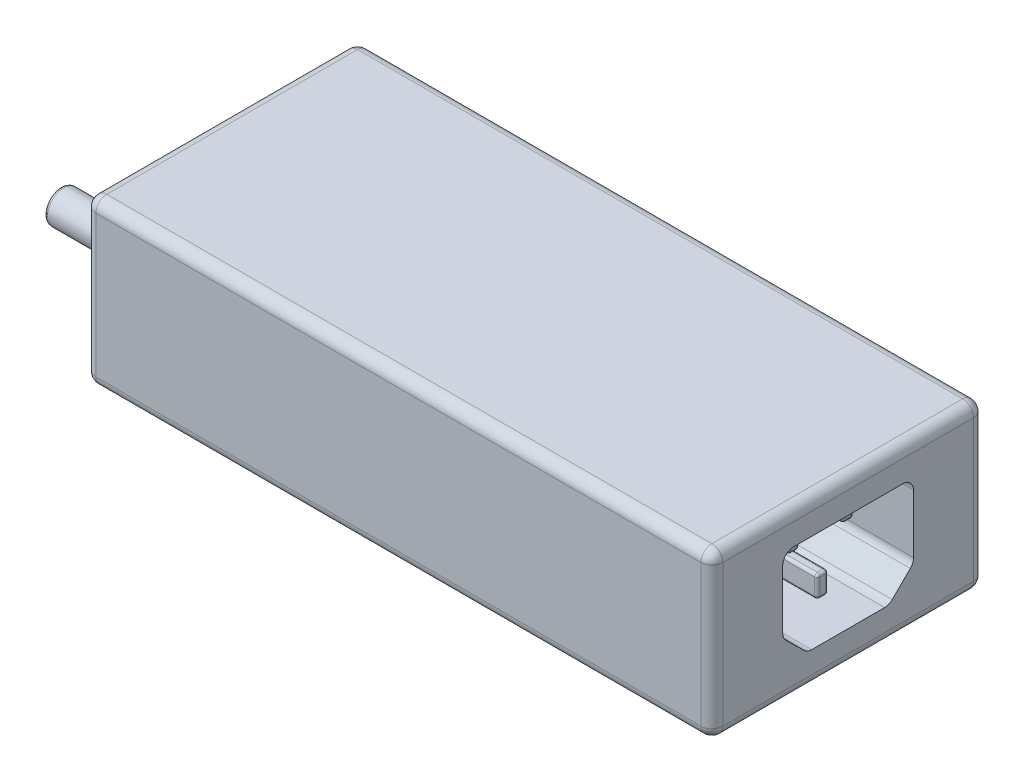
from build123d import *

# Parameters (mm, degrees)
SKETCH1_W           = 115
SKETCH1_H           = 50
BOSS_EXTRUDE1_DEPTH = 30
FILLET1_R           = 2
CUT_EXTRUDE1_DEPTH  = 20
SKETCH3_W           = 2
SKETCH3_H           = 4
BOSS_EXTRUDE2_DEPTH = 15
FILLET2_R           = 0.5
SKETCH6_R           = 3
BOSS_EXTRUDE3_DEPTH = 15
FILLET4_SIZE        = 0.5


with BuildPart() as part:
    # Sketch1 → Boss-Extrude1 (new body)
    with BuildSketch(Plane(origin=(0, 0, 0), x_dir=(1, 0, 0), z_dir=(0, 1, 0))):
        Rectangle(SKETCH1_W, SKETCH1_H)
    extrude(amount=BOSS_EXTRUDE1_DEPTH)

    # Fillet1
    fillet1_edges = [part.edges().sort_by_distance(p)[0] for p in [
        (57.5, 30, 0),
        (0, 30, -25),
        (-57.5, 30, 0),
        (0, 0, -25),
        (57.5, 0, 0),
        (0, 0, 25),
        (-57.5, 0, 0),
        (0, 30, 25),
        (-57.5, 15, -25),
        (57.5, 15, -25),
        (57.5, 15, 25),
        (-57.5, 15, 25),
    ]]
    fillet(fillet1_edges, radius=FILLET1_R)

    # Sketch2 → Cut-Extrude1 (cut)
    with BuildSketch(Plane(origin=(57.5, 0, 0), x_dir=(0, 0, -1), z_dir=(1, 0, 0))):
        with BuildLine():
            Line((-10, 24), (10, 24))
            ThreePointArc((10, 24), (11.414213562, 23.414213562), (12, 22))
            Line((12, 22), (12, 11.272713236))
            ThreePointArc((12, 11.272713236), (11.845000604, 10.500720509), (11.40402723, 9.848386189))
            Line((11.40402723, 9.848386189), (8.083996193, 6.575672953))
            ThreePointArc((8.083996193, 6.575672953), (7.438700109, 6.149506269), (6.679968963, 6))
            Line((6.679968963, 6), (-6.679968963, 6))
            ThreePointArc((-6.679968963, 6), (-7.438700109, 6.149506269), (-8.083996193, 6.575672953))
            Line((-8.083996193, 6.575672953), (-11.40402723, 9.848386189))
            ThreePointArc((-11.40402723, 9.848386189), (-11.845000604, 10.500720509), (-12, 11.272713236))
            Line((-12, 11.272713236), (-12, 22))
            ThreePointArc((-12, 22), (-11.414213562, 23.414213562), (-10, 24))
        make_face()
    extrude(amount=-CUT_EXTRUDE1_DEPTH, mode=Mode.SUBTRACT)

    # Sketch3 → Boss-Extrude2 (add)
    with BuildSketch(Plane(origin=(37.5, 0, 0), x_dir=(0, 0, -1), z_dir=(1, 0, 0))):
        with Locations((-5, 20.092368614)):
            Rectangle(SKETCH3_W, SKETCH3_H)
        with Locations((0.347775448, 10.265673995)):
            Rectangle(SKETCH3_W, SKETCH3_H)
        with Locations((5, 20.092368614)):
            Rectangle(SKETCH3_W, SKETCH3_H)
    extrude(amount=BOSS_EXTRUDE2_DEPTH)

    # Fillet2
    fillet2_edges = [part.edges().sort_by_distance(p)[0] for p in [
        (37.5, 10.265673995, -1.347775448),
        (45, 8.265673995, -1.347775448),
        (37.5, 12.265673995, -0.347775448),
        (45, 12.265673995, -1.347775448),
        (37.5, 10.265673995, 0.652224552),
        (45, 12.265673995, 0.652224552),
        (37.5, 8.265673995, -0.347775448),
        (45, 8.265673995, 0.652224552),
        (52.5, 10.265673995, -1.347775448),
        (52.5, 12.265673995, -0.347775448),
        (52.5, 10.265673995, 0.652224552),
        (52.5, 8.265673995, -0.347775448),
        (37.5, 20.092368614, -6),
        (45, 18.092368614, -6),
        (37.5, 22.092368614, -5),
        (45, 22.092368614, -6),
        (37.5, 20.092368614, -4),
        (45, 22.092368614, -4),
        (37.5, 18.092368614, -5),
        (45, 18.092368614, -4),
        (52.5, 20.092368614, -6),
        (52.5, 22.092368614, -5),
        (52.5, 20.092368614, -4),
        (52.5, 18.092368614, -5),
        (37.5, 20.092368614, 4),
        (45, 18.092368614, 4),
        (37.5, 22.092368614, 5),
        (45, 22.092368614, 4),
        (37.5, 20.092368614, 6),
        (45, 22.092368614, 6),
        (37.5, 18.092368614, 5),
        (45, 18.092368614, 6),
        (52.5, 20.092368614, 4),
        (52.5, 22.092368614, 5),
        (52.5, 20.092368614, 6),
        (52.5, 18.092368614, 5),
    ]]
    fillet(fillet2_edges, radius=FILLET2_R)

    # Sketch6 → Boss-Extrude3 (add)
    with BuildSketch(Plane.ZY.offset(57.5)):
        with Locations(Location((14.399111254, 15.476625634, 0), (0, 0, 180))):
            Circle(SKETCH6_R)
    extrude(amount=BOSS_EXTRUDE3_DEPTH)

    # Fillet4
    # a fillet whose section is not a circle: 0.5 mm, written as the material it takes off along each edge
    with BuildSketch(Plane(origin=(-72.5, 15.476625634, 14.399111254), x_dir=(0, 0, -1), z_dir=(0, 1, 0))) as fillet4_piece_1:
        with BuildLine():
            Bezier((3, -FILLET4_SIZE), (3, 0), (3 - FILLET4_SIZE, 0), weights=[1, 1, 1])
            Line((3 - FILLET4_SIZE, 0), (3, 0))
            Line((3, 0), (3, -FILLET4_SIZE))
        make_face()
    revolve(axis=Axis((-72.5, 15.476625634, 14.399111254), (-1, 0, 0)), mode=Mode.SUBTRACT)


solid = part.part
